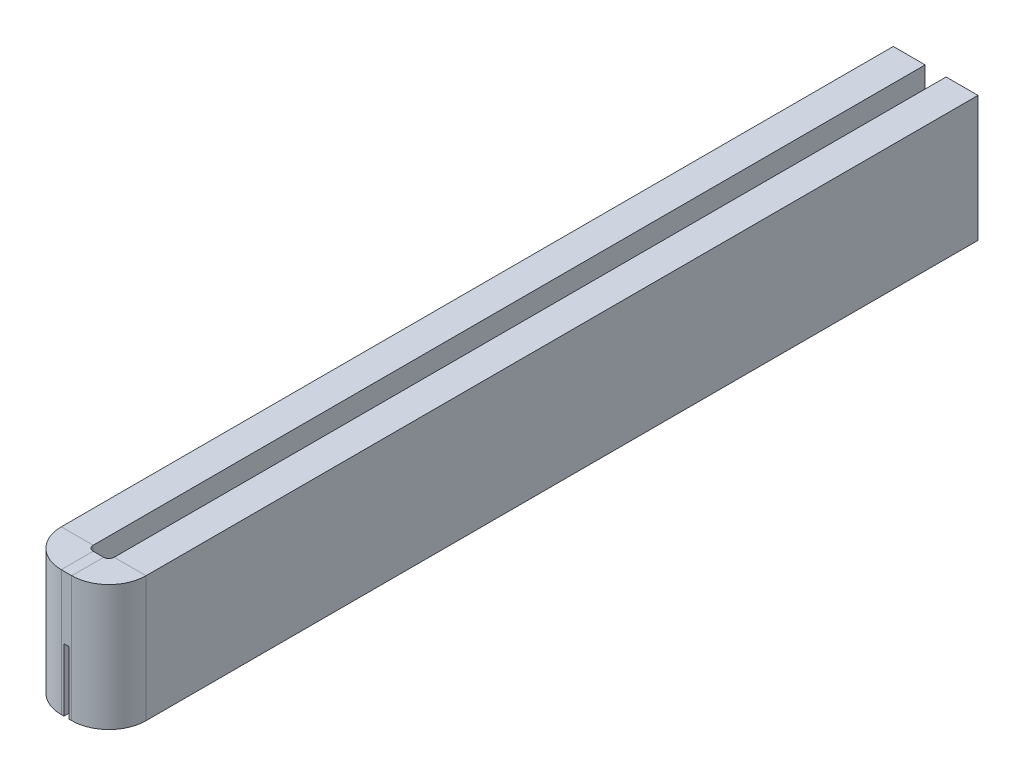
from build123d import *

# Parameters (mm, degrees)
SKETCH2_W               = 2
SKETCH2_H               = 80
BOSS_EXTRUDE1_DEPTH     = 6
CONVERT_SOLID1_START    = -6
CONVERT_SOLID1_DEPTH    = 12
CONVERT_SOLID1_2_DEPTH  = 12
CUT_EXTRUDE1_DEPTH      = 81.326747127
CUT_EXTRUDE1_DEPTH_BACK = 81.326747127
SKETCH7_W               = 0.5
SKETCH7_H               = 6


# Read off the part's stored shape, not the designer's step: SharpBend1
with BuildPart() as part:
    # Sketch2 → Boss-Extrude1 (new, symmetric)
    with BuildSketch(Plane(origin=(0, 0, 0), x_dir=(1, 0, 0), z_dir=(0, 1, 0))):
        with Locations((0, 40)):
            Rectangle(SKETCH2_W, SKETCH2_H)
    extrude(amount=BOSS_EXTRUDE1_DEPTH, both=True)

    # Convert-Solid1 outline → Convert-Solid1 (cut)
    with BuildSketch(Plane(origin=(0, 0, 0), x_dir=(1, 0, 0), z_dir=(0, 1, 0)).offset(CONVERT_SOLID1_START)):
        with BuildLine():
            Line((1, 0.5), (1, 80))
            Line((1, 80), (-1, 80))
            Line((-1, 80), (-1, 0.5))
            ThreePointArc((-1, 0.5), (-0.853553391, 0.146446609), (-0.5, 0))
            Line((-0.5, 0), (0.5, 0))
            ThreePointArc((0.5, 0), (0.853553391, 0.146446609), (1, 0.5))
        make_face()
    extrude(amount=CONVERT_SOLID1_DEPTH, mode=Mode.SUBTRACT)

    # Convert-Solid1 2 outline → Convert-Solid1 2 (add)
    with BuildSketch(Plane(origin=(0, 0, 0), x_dir=(1, 0, 0), z_dir=(0, 1, 0)).offset(CONVERT_SOLID1_START)):
        with BuildLine():
            Line((4.048, 0.5), (4.048, 80))
            Line((4.048, 80), (1, 80))
            Line((1, 80), (1, 0))
            Line((1, 0), (-1, 0))
            Line((-1, 0), (-1, 80))
            Line((-1, 80), (-4.048, 80))
            Line((-4.048, 80), (-4.048, 0.5))
            ThreePointArc((-4.048, 0.5), (-3.00881486, -2.00881486), (-0.5, -3.048))
            Line((-0.5, -3.048), (0.5, -3.048))
            ThreePointArc((0.5, -3.048), (3.00881486, -2.00881486), (4.048, 0.5))
        make_face()
    extrude(amount=CONVERT_SOLID1_2_DEPTH)

    # Sketch7 → Cut-Extrude1 (cut, two sides: drawn at the far end of the back side and taken through both)
    with BuildSketch(Plane.XY.offset(-CUT_EXTRUDE1_DEPTH_BACK)):
        with Locations((0, -3)):
            Rectangle(SKETCH7_W, SKETCH7_H)
    extrude(amount=CUT_EXTRUDE1_DEPTH + CUT_EXTRUDE1_DEPTH_BACK, mode=Mode.SUBTRACT)


solid = part.part
